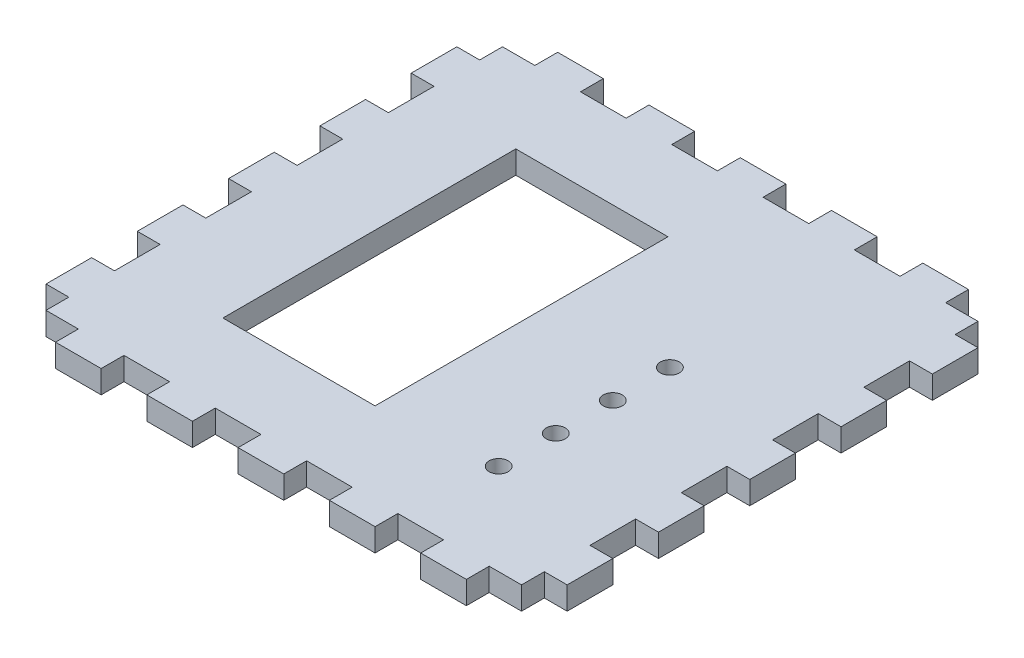
from build123d import *

# Parameters (mm, degrees)
SKETCH1_R           = 2.5
SKETCH1_W           = 40
SKETCH1_H           = 77
BOSS_EXTRUDE2_DEPTH = 6


with BuildPart() as part:
    # Sketch1 → Boss-Extrude2 (new body)
    with BuildSketch(Plane(origin=(0, 0, 0), x_dir=(1, 0, 0), z_dir=(0, 1, 0))):
        Polygon((-62.5, -54), (-62.5, -60), (-54, -60), (-54, -66), (-42, -66), (-42, -60), (-30, -60), (-30, -66), (-18, -66), (-18, -60), (-6, -60), (-6, -66), (6, -66), (6, -60), (18, -60), (18, -66), (30, -66), (30, -60), (42, -60), (42, -66), (54, -66), (54, -60), (62.5, -60), (62.5, -54), (68.5, -54), (68.5, -42), (62.5, -42), (62.5, -30), (68.5, -30), (68.5, -18), (62.5, -18), (62.5, -6), (68.5, -6), (68.5, 6), (62.5, 6), (62.5, 18), (68.5, 18), (68.5, 30), (62.5, 30), (62.5, 42), (68.5, 42), (68.5, 54), (62.5, 54), (62.5, 60), (54, 60), (54, 66), (42, 66), (42, 60), (30, 60), (30, 66), (18, 66), (18, 60), (6, 60), (6, 66), (-6, 66), (-6, 60), (-18, 60), (-18, 66), (-30, 66), (-30, 60), (-42, 60), (-42, 66), (-54, 66), (-54, 60), (-62.5, 60), (-62.5, 54), (-68.5, 54), (-68.5, 42), (-62.5, 42), (-62.5, 30), (-68.5, 30), (-68.5, 18), (-62.5, 18), (-62.5, 6), (-68.5, 6), (-68.5, -6), (-62.5, -6), (-62.5, -18), (-68.5, -18), (-68.5, -30), (-62.5, -30), (-62.5, -42), (-68.5, -42), (-68.5, -54), align=None)
        with Locations((32.5, -36)):
            Circle(SKETCH1_R, mode=Mode.SUBTRACT)
        with Locations((32.5, -21)):
            Circle(SKETCH1_R, mode=Mode.SUBTRACT)
        with Locations((32.5, -6)):
            Circle(SKETCH1_R, mode=Mode.SUBTRACT)
        with Locations((-17.5, 0)):
            Rectangle(SKETCH1_W, SKETCH1_H, mode=Mode.SUBTRACT)
        with Locations((32.5, 9)):
            Circle(SKETCH1_R, mode=Mode.SUBTRACT)
    extrude(amount=BOSS_EXTRUDE2_DEPTH)


solid = part.part
